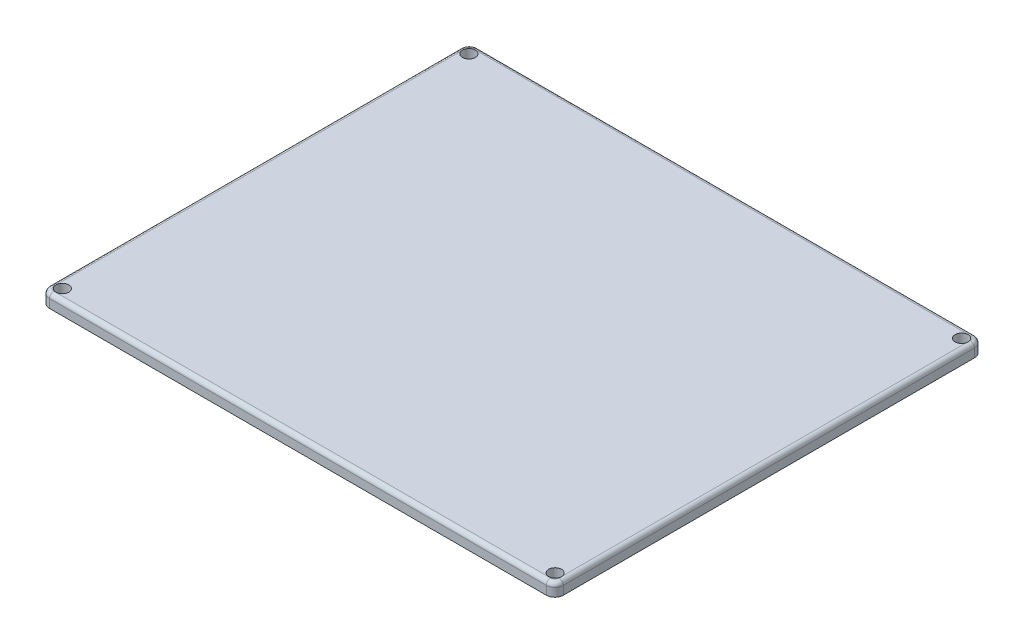
from build123d import *

# Parameters (mm, degrees)
SKETCH1_W           = 120
SKETCH1_H           = 100
BOSS_EXTRUDE1_DEPTH = 3
SKETCH2_R           = 1.5
CUT_EXTRUDE1_DEPTH  = 79.160092119
FILLET2_R           = 1
FILLET4_R           = 2


with BuildPart() as part:
    # Sketch1 → Boss-Extrude1 (new body)
    with BuildSketch(Plane(origin=(0, 0, 0), x_dir=(1, 0, 0), z_dir=(0, 1, 0))):
        Rectangle(SKETCH1_W, SKETCH1_H)
    extrude(amount=BOSS_EXTRUDE1_DEPTH)

    # Sketch2 → Cut-Extrude1 (cut, through all)
    with BuildSketch(Plane(origin=(0, 0, 0), x_dir=(-1, 0, 0), z_dir=(0, -1, 0))):
        with Locations(Location((57.529023281, -47.465069221, 0), (0, 0, 90))):
            Circle(SKETCH2_R)
        with Locations(Location((57.529023281, 47.465069221, 0), (0, 0, 270))):
            Circle(SKETCH2_R)
        with Locations(Location((-57.529023281, 47.465069221, 0), (0, 0, 90))):
            Circle(SKETCH2_R)
        with Locations(Location((-57.529023281, -47.465069221, 0), (0, 0, 270))):
            Circle(SKETCH2_R)
    extrude(amount=-CUT_EXTRUDE1_DEPTH, mode=Mode.SUBTRACT)

    # Fillet2
    fillet2_edges = [part.edges().sort_by_distance(p)[0] for p in [
        (-60, 3, 0),
        (0, 3, 50),
        (60, 3, 0),
        (0, 3, -50),
    ]]
    fillet(fillet2_edges, radius=FILLET2_R)

    # Fillet4
    # the kernel refuses this fillet: 2 mm, written as the material it takes off along each edge
    with BuildSketch(Plane(origin=(58, 3, -48), x_dir=(1, 0, 0), z_dir=(0, 0, 1))) as fillet4_piece_1:
        with BuildLine():
            CenterArc((1, -1), 1, 0, 90)
            Line((2, -1), (2, 0))
            Line((2, 0), (1, 0))
        make_face()
    revolve(axis=Axis((58, 3, -48), (0, 1, 0)), revolution_arc=90, mode=Mode.SUBTRACT)
    with BuildSketch(Plane(origin=(58, 3, 48), x_dir=(0, 0, 1), z_dir=(-1, 0, 0))) as fillet4_piece_2:
        with BuildLine():
            CenterArc((1, -1), 1, 0, 90)
            Line((2, -1), (2, 0))
            Line((2, 0), (1, 0))
        make_face()
    revolve(axis=Axis((58, 3, 48), (0, 1, 0)), revolution_arc=90, mode=Mode.SUBTRACT)
    with BuildSketch(Plane(origin=(-58, 3, -48), x_dir=(0, 0, -1), z_dir=(1, 0, 0))) as fillet4_piece_3:
        with BuildLine():
            CenterArc((1, -1), 1, 0, 90)
            Line((2, -1), (2, 0))
            Line((2, 0), (1, 0))
        make_face()
    revolve(axis=Axis((-58, 3, -48), (0, 1, 0)), revolution_arc=90, mode=Mode.SUBTRACT)
    with BuildSketch(Plane(origin=(-58, 3, 48), x_dir=(-1, 0, 0), z_dir=(0, 0, -1))) as fillet4_piece_4:
        with BuildLine():
            CenterArc((1, -1), 1, 0, 90)
            Line((2, -1), (2, 0))
            Line((2, 0), (1, 0))
        make_face()
    revolve(axis=Axis((-58, 3, 48), (0, 1, 0)), revolution_arc=90, mode=Mode.SUBTRACT)
    with BuildSketch(Plane(origin=(-60, -5, 50), x_dir=(0, 0, -1), z_dir=(0, 1, 0)), Plane(origin=(-60, -5, -50), x_dir=(1, 0, 0), z_dir=(0, 1, 0))) as fillet4_piece_5:
        with BuildLine():
            CenterArc((FILLET4_R, -FILLET4_R), FILLET4_R, 90, 90)
            Line((0, -FILLET4_R), (0, 0))
            Line((0, 0), (FILLET4_R, 0))
        make_face()
    extrude(amount=8, mode=Mode.SUBTRACT)
    with BuildSketch(Plane(origin=(60, -5, 50), x_dir=(0, 0, -1), z_dir=(0, 1, 0)), Plane(origin=(60, -5, -50), x_dir=(-1, 0, 0), z_dir=(0, 1, 0))) as fillet4_piece_6:
        with BuildLine():
            CenterArc((FILLET4_R, FILLET4_R), FILLET4_R, 180, 90)
            Line((0, FILLET4_R), (0, 0))
            Line((0, 0), (FILLET4_R, 0))
        make_face()
    extrude(amount=8, mode=Mode.SUBTRACT)


solid = part.part
